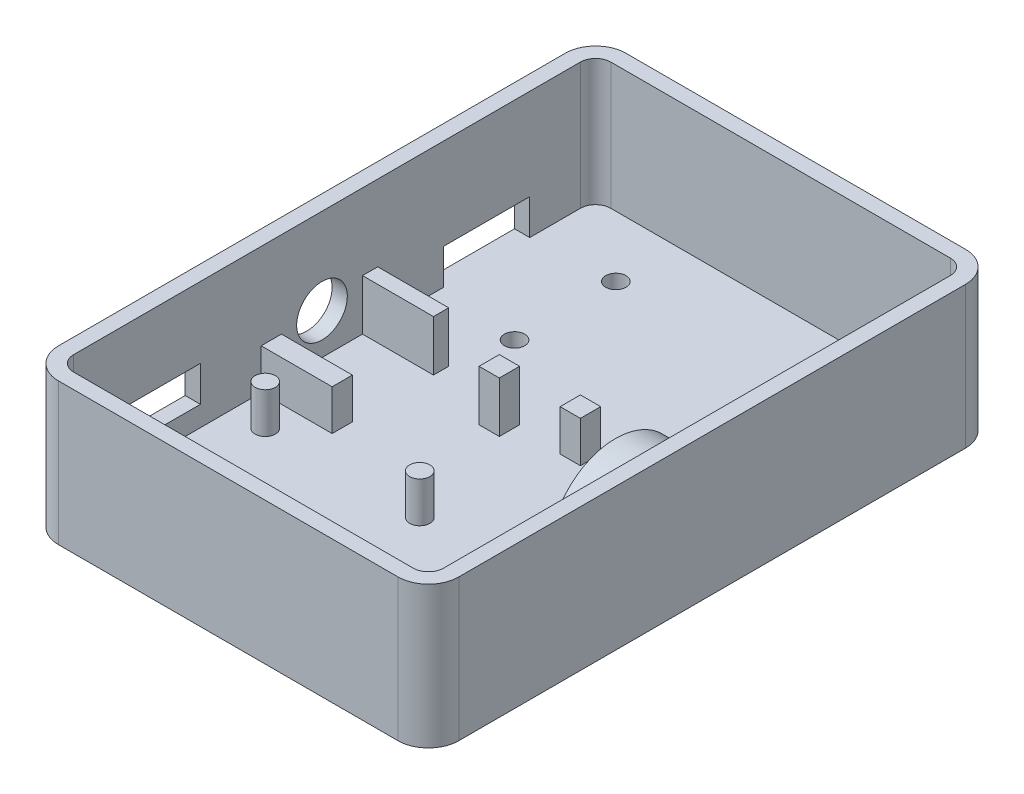
from build123d import *

# Parameters (mm, degrees)
SKETCH2_W            = 39.5
SKETCH2_H            = 56
BOSS_EXTRUDE1_DEPTH  = 14
FILLET1_R            = 3
SHELL1_T             = -1.5
SKETCH3_W            = 7
SKETCH3_H            = 2
SKETCH3_W_2          = 2
SKETCH3_H_2          = 5
BOSS_EXTRUDE3_DEPTH  = 4
SKETCH4_W            = 2
SKETCH4_H            = 2
BOSS_EXTRUDE4_DEPTH  = 4.052221169
SKETCH6_W            = 8
SKETCH6_H            = 3.5
CUT_EXTRUDE1_DEPTH   = 70.108610173
SKETCH7_R            = 1
BOSS_EXTRUDE5_DEPTH  = 4
SKETCH8_W            = 8.5
SKETCH8_H            = 3.5
CUT_EXTRUDE2_DEPTH   = 70.108610173
SKETCH12_R           = 6.5
BOSS_EXTRUDE7_DEPTH  = 3.5
SKETCH13_R           = 5.15
CUT_EXTRUDE5_DEPTH   = 3.5
SKETCH15_W           = 1.3
SKETCH15_H           = 3.704358433
BOSS_EXTRUDE8_DEPTH  = 3.5
SKETCH16_W           = 2.3
SKETCH16_H           = 1.398241718
BOSS_EXTRUDE9_DEPTH  = 3.5
SKETCH17_W           = 1.2
SKETCH17_H           = 5.421175269
BOSS_EXTRUDE10_DEPTH = 3.5
SKETCH18_W           = 2.4
SKETCH18_H           = 1.320829883
BOSS_EXTRUDE12_DEPTH = 3.5
SKETCH21_W           = 4
SKETCH21_H           = 3
CUT_EXTRUDE6_DEPTH   = 3.5
SKETCH22_R           = 1
CUT_EXTRUDE7_DEPTH   = 70.659888027
SKETCH23_R           = 2.5
CUT_EXTRUDE8_DEPTH   = 10
SKETCH25_W           = 7
SKETCH25_H           = 1.5
SKETCH25_W_2         = 2
SKETCH25_H_2         = 2
BOSS_EXTRUDE13_DEPTH = 5
SKETCH28_R           = 1
CUT_EXTRUDE10_DEPTH  = 70.659888027


with BuildPart() as part:
    # Sketch2 → Boss-Extrude1 (new body)
    with BuildSketch(Plane(origin=(0, 0, 0), x_dir=(1, 0, 0), z_dir=(0, 1, 0))):
        with Locations((19.75, 28)):
            Rectangle(SKETCH2_W, SKETCH2_H)
    extrude(amount=BOSS_EXTRUDE1_DEPTH)

    # Fillet1
    fillet1_edges = [part.edges().sort_by_distance(p)[0] for p in [
        (0, 7, 0),
        (0, 7, -56),
        (39.5, 7, -56),
        (39.5, 7, 0),
    ]]
    fillet(fillet1_edges, radius=FILLET1_R)

    # Shell1
    shell1_openings = [part.faces().sort_by_distance(p)[0] for p in [
        (19.75, 14, -28),
    ]]
    offset(amount=SHELL1_T, openings=shell1_openings, kind=Kind.INTERSECTION)

    # Sketch3 → Boss-Extrude3 (add)
    with BuildSketch(Plane(origin=(0, 1.5, 0), x_dir=(1, 0, 0), z_dir=(0, 1, 0))):
        with Locations((5, 22.5)):
            Rectangle(SKETCH3_W, SKETCH3_H)
        with Locations((23.5, 4)):
            Rectangle(SKETCH3_W_2, SKETCH3_H_2)
    extrude(amount=BOSS_EXTRUDE3_DEPTH)

    # Sketch4 → Boss-Extrude4 (add)
    with BuildSketch(Plane(origin=(0, 1.5, 0), x_dir=(1, 0, 0), z_dir=(0, 1, 0))):
        with Locations((22.5, 32)):
            Rectangle(SKETCH4_W, SKETCH4_H)
    extrude(amount=BOSS_EXTRUDE4_DEPTH)

    # Sketch6 → Cut-Extrude1 (cut, through all)
    with BuildSketch(Plane(origin=(1.5, 0, 0), x_dir=(0, 0, -1), z_dir=(1, 0, 0))):
        with Locations((11.5, 5.25)):
            Rectangle(SKETCH6_W, SKETCH6_H)
    extrude(amount=-CUT_EXTRUDE1_DEPTH, mode=Mode.SUBTRACT)

    # Sketch7 → Boss-Extrude5 (add)
    with BuildSketch(Plane(origin=(0, 1.5, 0), x_dir=(1, 0, 0), z_dir=(0, 1, 0))):
        with Locations((4.75, 18.65)):
            Circle(SKETCH7_R)
        with Locations((20, 18.65)):
            Circle(SKETCH7_R)
        with Locations((4.75, 4.35)):
            Circle(SKETCH7_R)
        with Locations((20, 4.35)):
            Circle(SKETCH7_R)
    extrude(amount=BOSS_EXTRUDE5_DEPTH)

    # Sketch8 → Cut-Extrude2 (cut, through all)
    with BuildSketch(Plane(origin=(1.5, 0, 0), x_dir=(0, 0, -1), z_dir=(1, 0, 0))):
        with Locations((43.75, 3.25)):
            Rectangle(SKETCH8_W, SKETCH8_H)
    extrude(amount=-CUT_EXTRUDE2_DEPTH, mode=Mode.SUBTRACT)

    # Sketch12 → Boss-Extrude7 (add)
    with BuildSketch(Plane.ZY.offset(-38)):
        with Locations((-23.469922622, 6.6)):
            Circle(SKETCH12_R)
    extrude(amount=BOSS_EXTRUDE7_DEPTH)

    # Sketch13 → Cut-Extrude5 (cut)
    with BuildSketch(Plane.ZY.offset(-34.5)):
        with Locations((-23.469922622, 6.6)):
            Circle(SKETCH13_R)
    extrude(amount=-CUT_EXTRUDE5_DEPTH, mode=Mode.SUBTRACT)

    # Sketch15 → Boss-Extrude8 (add)
    with BuildSketch(Plane.ZY.offset(-38)):
        with Locations((-29.146876513, 3.352179217)):
            Rectangle(SKETCH15_W, SKETCH15_H)
    extrude(amount=BOSS_EXTRUDE8_DEPTH)

    # Sketch16 → Boss-Extrude9 (add)
    with BuildSketch(Plane.ZY.offset(-38)):
        with Locations((-28.646876513, 2.199120859)):
            Rectangle(SKETCH16_W, SKETCH16_H)
    extrude(amount=BOSS_EXTRUDE9_DEPTH)

    # Sketch17 → Boss-Extrude10 (add)
    with BuildSketch(Plane.ZY.offset(-38)):
        with Locations((-17.651553886, 4.210587635)):
            Rectangle(SKETCH17_W, SKETCH17_H)
    extrude(amount=BOSS_EXTRUDE10_DEPTH)

    # Sketch18 → Boss-Extrude12 (add)
    with BuildSketch(Plane.ZY.offset(-38)):
        with Locations((-18.251553886, 2.160414942)):
            Rectangle(SKETCH18_W, SKETCH18_H)
    extrude(amount=BOSS_EXTRUDE12_DEPTH)

    # Sketch21 → Cut-Extrude6 (cut)
    with BuildSketch(Plane.ZY.offset(-34.5)):
        with Locations((-28.400298424, 7.23482229)):
            Rectangle(SKETCH21_W, SKETCH21_H)
    extrude(amount=-CUT_EXTRUDE6_DEPTH, mode=Mode.SUBTRACT)

    # Sketch22 → Cut-Extrude7 (cut, through all)
    with BuildSketch(Plane(origin=(0, 1.5, 0), x_dir=(1, 0, 0), z_dir=(0, 1, 0))):
        with Locations((9.5, 38.5)):
            Circle(SKETCH22_R)
    extrude(amount=-CUT_EXTRUDE7_DEPTH, mode=Mode.SUBTRACT)

    # Sketch23 → Cut-Extrude8 (cut)
    with BuildSketch(Plane(origin=(1.5, 0, 0), x_dir=(0, 0, -1), z_dir=(1, 0, 0))):
        with Locations((27.5, 5.5)):
            Circle(SKETCH23_R)
    extrude(amount=-CUT_EXTRUDE8_DEPTH, mode=Mode.SUBTRACT)

    # Sketch25 → Boss-Extrude13 (add)
    with BuildSketch(Plane(origin=(0, 1.5, 0), x_dir=(1, 0, 0), z_dir=(0, 1, 0))):
        with Locations((5, 32.25)):
            Rectangle(SKETCH25_W, SKETCH25_H)
        with Locations((16, 30.5)):
            Rectangle(SKETCH25_W_2, SKETCH25_H_2)
    extrude(amount=BOSS_EXTRUDE13_DEPTH)

    # Sketch28 → Cut-Extrude10 (cut, through all)
    with BuildSketch(Plane(origin=(0, 1.5, 0), x_dir=(1, 0, 0), z_dir=(0, 1, 0))):
        with Locations((9.5, 48.5)):
            Circle(SKETCH28_R)
    extrude(amount=-CUT_EXTRUDE10_DEPTH, mode=Mode.SUBTRACT)


solid = part.part
